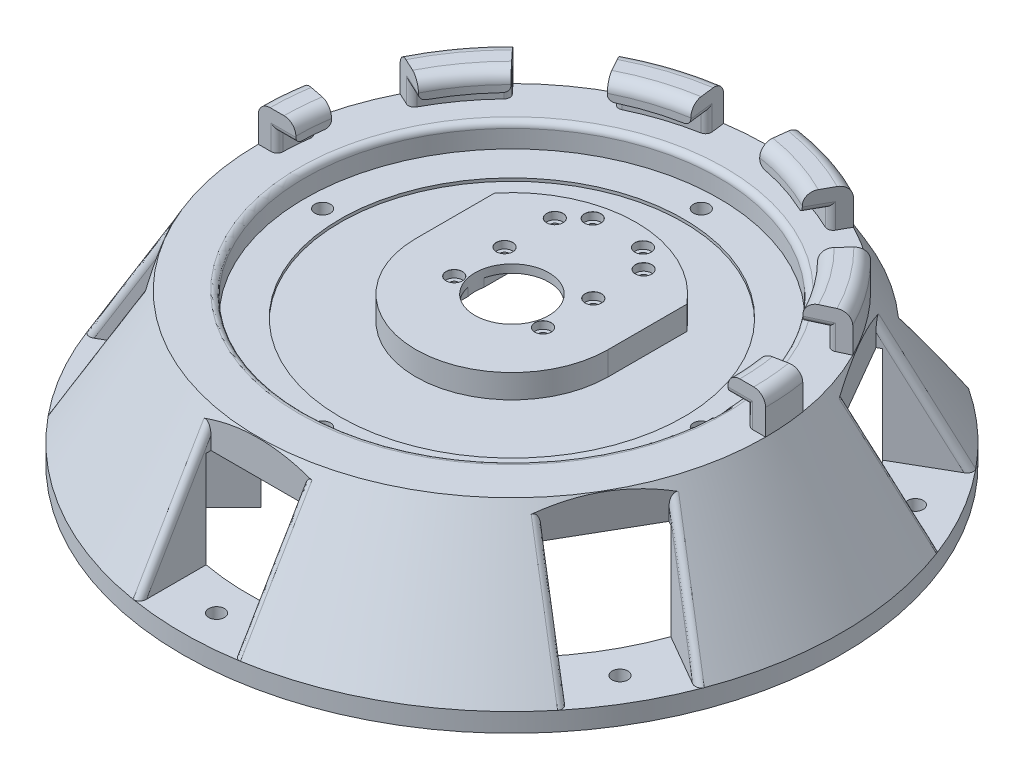
from build123d import *

# Parameters (mm, degrees)
SKETCH2_R                       = 12.5
CUT_EXTRUDE1_DEPTH              = 171.457229262
SKETCH3_R                       = 69.999999954
CUT_EXTRUDE2_DEPTH              = 8.000000002
CUT_EXTRUDE5_DEPTH              = 39
SKETCH8_W                       = 31.75
SKETCH8_H                       = 38.1
CUT_EXTRUDE6_DEPTH              = 44.45
CIRPATTERN2_COUNT               = 6
SKETCH9_R                       = 2.649982
CUT_EXTRUDE7_DEPTH              = 171.457229262
CIRPATTERN3_COUNT               = 6
REVOLVE2_ANGLE                  = 180
CUT_EXTRUDE9_DEPTH              = 12.7
SKETCH3_3_R                     = 12.5
CUT_EXTRUDE11_DEPTH             = 1
CBORE_FOR_M2_5_SHCS1_AT_2_COUNT = 2
CBORE_FOR_M2_5_SHCS1_AT_2_PITCH = 17
CBORE_FOR_M2_5_SHCS1_AT_3_COUNT = 2
CBORE_FOR_M2_5_SHCS1_AT_3_PITCH = 34
CBORE_FOR_M2_5_SHCS1_AT_4_COUNT = 2
CBORE_FOR_M2_5_SHCS1_AT_4_PITCH = 40.820828017
CBORE_FOR_M2_5_SHCS1_AT_5_COUNT = 2
CBORE_FOR_M2_5_SHCS1_AT_5_PITCH = 46.651259361
CBORE_FOR_M2_5_SHCS1_AT_6_COUNT = 2
CBORE_FOR_M2_5_SHCS1_AT_6_PITCH = 45.343136195
CBORE_FOR_M2_5_SHCS1_AT_7_COUNT = 2
CBORE_FOR_M2_5_SHCS1_AT_7_PITCH = 34.481879299
CBORE_FOR_M2_5_SHCS1_AT_8_COUNT = 2
CBORE_FOR_M2_5_SHCS1_AT_8_PITCH = 30
FILLET1_R                       = 4
FILLET2_R                       = 2
FILLET3_R                       = 2
FILLET4_R                       = 2
FILLET5_R                       = 2
FILLET9_R                       = 1
CUT_EXTRUDE12_DEPTH             = 8.05
CUT_EXTRUDE15_START             = -5.3
SKETCH20_R                      = 1.45
CUT_EXTRUDE15_DEPTH             = 5.3
M5_CLEARANCE_HOLE1_D            = 5.3
SKETCH34_R                      = 58
CUT_EXTRUDE16_DEPTH             = 1
BOSS_EXTRUDE1_DEPTH             = 39
FILLET10_R                      = 10
SKETCH37_R                      = 121.388219465
SKETCH37_R_2                    = 111.388219465
CUT_EXTRUDE_THIN1_DEPTH         = 171.457229427


with BuildPart() as part:
    # Sketch1 → Revolve1 (revolve)
    with BuildSketch(Plane.XY, mode=Mode.PRIVATE) as revolve1_sk:
        Polygon((0, 0), (-85.725, 0), (-115.054393675, -50.8), (0, -50.8), align=None)
    revolve(revolve1_sk.sketch.rotate(Axis((0, 0, 0), (0, -1, 0)), 270), axis=Axis((0, 0, 0), (0, -1, 0)))

    # Sketch2 → Cut-Extrude1 (cut, through all)
    with BuildSketch(Plane(origin=(0, 0, 0), x_dir=(1, 0, 0), z_dir=(0, 1, 0))):
        with Locations(Location((0, 0, 0), (0, 0, 270))):
            Circle(SKETCH2_R)
    extrude(amount=-CUT_EXTRUDE1_DEPTH, mode=Mode.SUBTRACT)

    # Sketch3 → Cut-Extrude2 (cut)
    with BuildSketch(Plane(origin=(0, 0, 0), x_dir=(1, 0, 0), z_dir=(0, 1, 0))):
        with Locations(Location((0, 0, 0), (0, 0, 270))):
            Circle(SKETCH3_R)
        with BuildLine():
            ThreePointArc((32.5, 0), (0, -32.5), (-32.5, 0))
            Line((-32.5, 0), (-32.5, 26.603571189))
            ThreePointArc((-32.5, 26.603571189), (0, 42), (32.5, 26.603571189))
            Line((32.5, 26.603571189), (32.5, 0))
        make_face(mode=Mode.SUBTRACT)
    extrude(amount=-CUT_EXTRUDE2_DEPTH, mode=Mode.SUBTRACT)

    # Sketch7 → Cut-Extrude5 (cut)
    with BuildSketch(Plane.XZ.offset(50.8)):
        with BuildLine():
            Line((-60, -65.598856697), (-60, -161.1))
            Line((-60, -161.1), (60, -161.1))
            Line((60, -161.1), (60, -65.598856697))
            ThreePointArc((60, -65.598856697), (0, 88.9), (-60, -65.598856697))
        make_face()
    extrude(amount=-CUT_EXTRUDE5_DEPTH, mode=Mode.SUBTRACT)

    # Sketch8 → Cut-Extrude6 (cut)
    with BuildSketch(Plane(origin=(0, 0, 0), x_dir=(1, 0, 0), z_dir=(0, 1, 0))):
        with Locations((0, -104.875)):
            Rectangle(SKETCH8_W, SKETCH8_H)
    cut_extrude6 = extrude(amount=-CUT_EXTRUDE6_DEPTH, mode=Mode.SUBTRACT)

    # CirPattern2: Cut-Extrude6 ×6 about axis, 1 skipped
    cirpattern2_axis = Axis((0, 0, 0), (0, -1, 0))
    add([cut_extrude6.rotate(cirpattern2_axis, i * 360 / CIRPATTERN2_COUNT) for i in range(1, CIRPATTERN2_COUNT) if i not in (3,)], mode=Mode.SUBTRACT)

    # Sketch9 → Cut-Extrude7 (cut, through all)
    with BuildSketch(Plane(origin=(0, 0, 0), x_dir=(1, 0, 0), z_dir=(0, 1, 0))):
        with Locations(Location((0, -99.814393675, 0), (0, 0, 270))):
            Circle(SKETCH9_R)
    cut_extrude7 = extrude(amount=-CUT_EXTRUDE7_DEPTH, mode=Mode.SUBTRACT)

    # CirPattern3: Cut-Extrude7 ×6 about axis
    cirpattern3_axis = Axis((0, 0, 0), (0, 1, 0))
    for i in range(1, CIRPATTERN3_COUNT):
        add(cut_extrude7.rotate(cirpattern3_axis, i * 360 / CIRPATTERN3_COUNT), mode=Mode.SUBTRACT)

    # Sketch12 → Revolve2 (revolve)
    with BuildSketch(Plane.XY):
        Polygon((85.725, 0), (85.725, 12.7), (73.025, 12.7), (73.025, 6.35), (79.375, 6.35), (79.375, 0), align=None)
    revolve(axis=Axis((0, 0, 0), (0, 1, 0)), revolution_arc=REVOLVE2_ANGLE)

    # Sketch18 → Cut-Extrude9 (cut)
    with BuildSketch(Plane(origin=(0, 12.7, 0), x_dir=(1, 0, 0), z_dir=(0, 1, 0))):
        Polygon((46.643270314, 89.718478222), (70.913780145, 72.084920653), (36.670415564, 35.160782448), (22.108109665, 45.740916989), align=None)
        Polygon((-15, 100), (-9, 50), (9, 50), (15, 100), align=None)
        Polygon((90.470396714, 45.167547182), (99.740906545, 16.635851693), (50.333978764, 6.891341072), (44.771672865, 24.010358365), align=None)
        Polygon((99.740906545, -16.635851693), (90.470396714, -45.167547182), (44.771672865, -24.010358365), (50.333978764, -6.891341072), align=None)
        Polygon((70.913780145, -72.084920653), (46.643270314, -89.718478222), (22.108109665, -45.740916989), (36.670415564, -35.160782448), align=None)
        Polygon((15, -100), (-15, -100), (-9, -50), (9, -50), align=None)
        Polygon((-46.643270314, -89.718478222), (-70.913780145, -72.084920653), (-36.670415564, -35.160782448), (-22.108109665, -45.740916989), align=None)
        Polygon((-90.470396714, -45.167547182), (-99.740906545, -16.635851693), (-50.333978764, -6.891341072), (-44.771672865, -24.010358365), align=None)
        Polygon((-99.740906545, 16.635851693), (-90.470396714, 45.167547182), (-44.771672865, 24.010358365), (-50.333978764, 6.891341072), align=None)
        Polygon((-70.913780145, 72.084920653), (-46.643270314, 89.718478222), (-22.108109665, 45.740916989), (-36.670415564, 35.160782448), align=None)
    extrude(amount=-CUT_EXTRUDE9_DEPTH, mode=Mode.SUBTRACT)

    # Sketch3<3> → Cut-Extrude11 (cut)
    # profile 1 of 5: a face of its own
    with BuildSketch(Plane(origin=(0, 0, 0), x_dir=(1, 0, 0), z_dir=(0, 1, 0))):
        with BuildLine():
            ThreePointArc((-18.668154703, 26.603571189), (-28.835438507, 14.992247533), (-32.5, 0))
            ThreePointArc((-32.5, 0), (0, -32.5), (32.5, 0))
            ThreePointArc((32.5, 0), (28.835438507, 14.992247533), (18.668154703, 26.603571189))
            Line((18.668154703, 26.603571189), (-18.668154703, 26.603571189))
        make_face()
        with Locations(Location((0, 0, 0), (0, 0, 270))):
            Circle(SKETCH3_3_R, mode=Mode.SUBTRACT)
    # profile 2 of 5: a face of its own
    with BuildSketch(Plane(origin=(0, 0, 0), x_dir=(1, 0, 0), z_dir=(0, 1, 0))):
        with BuildLine():
            Line((-32.5, 26.603571189), (-32.5, 0))
            ThreePointArc((-32.5, 0), (-28.835438507, 14.992247533), (-18.668154703, 26.603571189))
            Line((-18.668154703, 26.603571189), (-32.5, 26.603571189))
        make_face()
    # profile 3 of 5: a face of its own
    with BuildSketch(Plane(origin=(0, 0, 0), x_dir=(1, 0, 0), z_dir=(0, 1, 0))):
        with BuildLine():
            ThreePointArc((18.668154703, 26.603571189), (0, 32.5), (-18.668154703, 26.603571189))
            Line((-18.668154703, 26.603571189), (18.668154703, 26.603571189))
        make_face()
    # profile 4 of 5: a face of its own
    with BuildSketch(Plane(origin=(0, 0, 0), x_dir=(1, 0, 0), z_dir=(0, 1, 0))):
        with BuildLine():
            ThreePointArc((32.5, 26.603571189), (0, 42), (-32.5, 26.603571189))
            Line((-32.5, 26.603571189), (-18.668154703, 26.603571189))
            ThreePointArc((-18.668154703, 26.603571189), (0, 32.5), (18.668154703, 26.603571189))
            Line((18.668154703, 26.603571189), (32.5, 26.603571189))
        make_face()
    # profile 5 of 5: a face of its own
    with BuildSketch(Plane(origin=(0, 0, 0), x_dir=(1, 0, 0), z_dir=(0, 1, 0))):
        with BuildLine():
            ThreePointArc((18.668154703, 26.603571189), (28.835438507, 14.992247533), (32.5, 0))
            Line((32.5, 0), (32.5, 26.603571189))
            Line((32.5, 26.603571189), (18.668154703, 26.603571189))
        make_face()
    extrude(amount=-CUT_EXTRUDE11_DEPTH, mode=Mode.SUBTRACT)

    # Sketch24 → CBORE for M2.5 SHCS1 (revolve, cut)
    with BuildSketch(Plane(origin=(-15, -1, 4.5), x_dir=(0, 0, 1), z_dir=(1, 0, 0))):
        Polygon((0, 0), (0, 49.8), (1.45, 49.8), (1.45, 2.5), (2.75, 2.5), (2.75, 0.025), (2.775, 0), align=None)
    cbore_for_m2_5_shcs1 = revolve(axis=Axis((-15, 5.35, 4.5), (0, -1, 0)), mode=Mode.SUBTRACT)

    # CBORE for M2.5 SHCS1 at 2: CBORE for M2.5 SHCS1 ×2
    with Locations(*[(0, 0, -i * CBORE_FOR_M2_5_SHCS1_AT_2_PITCH) for i in range(1, CBORE_FOR_M2_5_SHCS1_AT_2_COUNT)]):
        add(cbore_for_m2_5_shcs1, mode=Mode.SUBTRACT)

    # CBORE for M2.5 SHCS1 at 3: CBORE for M2.5 SHCS1 ×2
    with Locations(*[(0, 0, -i * CBORE_FOR_M2_5_SHCS1_AT_3_PITCH) for i in range(1, CBORE_FOR_M2_5_SHCS1_AT_3_COUNT)]):
        add(cbore_for_m2_5_shcs1, mode=Mode.SUBTRACT)

    # CBORE for M2.5 SHCS1 at 4: CBORE for M2.5 SHCS1 ×2
    with Locations(*[Vector(0.15923243882462063, 0, -0.9872411207126472) * (i * CBORE_FOR_M2_5_SHCS1_AT_4_PITCH) for i in range(1, CBORE_FOR_M2_5_SHCS1_AT_4_COUNT)]):
        add(cbore_for_m2_5_shcs1, mode=Mode.SUBTRACT)

    # CBORE for M2.5 SHCS1 at 5: CBORE for M2.5 SHCS1 ×2
    with Locations(*[Vector(0.5037377408822789, 0, -0.8638566364917376) * (i * CBORE_FOR_M2_5_SHCS1_AT_5_PITCH) for i in range(1, CBORE_FOR_M2_5_SHCS1_AT_5_COUNT)]):
        add(cbore_for_m2_5_shcs1, mode=Mode.SUBTRACT)

    # CBORE for M2.5 SHCS1 at 6: CBORE for M2.5 SHCS1 ×2
    with Locations(*[Vector(0.6616216370868465, 0, -0.7498378553650925) * (i * CBORE_FOR_M2_5_SHCS1_AT_6_PITCH) for i in range(1, CBORE_FOR_M2_5_SHCS1_AT_6_COUNT)]):
        add(cbore_for_m2_5_shcs1, mode=Mode.SUBTRACT)

    # CBORE for M2.5 SHCS1 at 7: CBORE for M2.5 SHCS1 ×2
    with Locations(*[Vector(0.8700221858486125, 0, -0.4930125719808802) * (i * CBORE_FOR_M2_5_SHCS1_AT_7_PITCH) for i in range(1, CBORE_FOR_M2_5_SHCS1_AT_7_COUNT)]):
        add(cbore_for_m2_5_shcs1, mode=Mode.SUBTRACT)

    # CBORE for M2.5 SHCS1 at 8: CBORE for M2.5 SHCS1 ×2
    with Locations(*[(i * CBORE_FOR_M2_5_SHCS1_AT_8_PITCH, 0, 0) for i in range(1, CBORE_FOR_M2_5_SHCS1_AT_8_COUNT)]):
        add(cbore_for_m2_5_shcs1, mode=Mode.SUBTRACT)

    # Fillet1
    fillet1_edges = [part.edges().sort_by_distance(p)[0] for p in [
        (-85.450905057, 12.7, -6.849704366),
        (-72.808821363, 12.7, -5.614815819),
        (-59.078466014, 12.7, -42.923018049),
        (-22.565966014, 12.7, -69.450902102),
        (22.565966014, 12.7, -69.450902102),
        (59.078466014, 12.7, -42.923018049),
        (72.808821363, 12.7, -5.614815819),
        (-69.352981843, 12.7, -50.387890753),
        (-26.490481843, 12.7, -81.529319859),
        (26.490481843, 12.7, -81.529319859),
        (69.352981843, 12.7, -50.387890753),
        (85.450905057, 12.7, -6.849704365),
    ]]
    fillet(fillet1_edges, radius=FILLET1_R)

    # Fillet2
    fillet2_edges = [part.edges().sort_by_distance(p)[0] for p in [
        (-76.2, 6.35, 0),
        (76.2, 6.35, 0),
        (67.844410645, 6.35, -34.692369341),
        (75.278944251, 6.35, -11.811227656),
        (34.49561812, 6.35, -67.9446604),
        (53.95947979, 6.35, -53.803337137),
        (-75.278944251, 6.35, -11.811227656),
        (-67.844410645, 6.35, -34.692369341),
        (-53.95947979, 6.35, -53.803337137),
        (-34.49561812, 6.35, -67.9446604),
        (12.029328065, 6.35, -75.24440054),
        (-12.029328065, 6.35, -75.24440054),
    ]]
    fillet(fillet2_edges, radius=FILLET2_R)

    # Fillet3
    fillet3_edges = [part.edges().sort_by_distance(p)[0] for p in [
        (-78.396323126, 4.175, -12.426067172),
        (-56.120098678, 4.175, -56.133102082),
        (-70.727816733, 4.175, -36.027303052),
        (-12.407903987, 4.175, -78.399199892),
        (56.120098678, 4.175, -56.133102082),
        (78.396323126, 4.175, -12.426067171),
        (-79.375, 4.175, 0),
        (-36.043688298, 4.175, -70.719468033),
        (12.407903987, 4.175, -78.399199892),
        (36.043688298, 4.175, -70.719468033),
        (70.727816733, 4.175, -36.027303052),
        (79.375, 4.175, 0),
    ]]
    fillet(fillet3_edges, radius=FILLET3_R)

    # Fillet4
    fillet4_edges = [part.edges().sort_by_distance(p)[0] for p in [
        (92.853698409, -23.56380487, 35.278236725),
        (76.978698409, -23.56380487, 62.774543295),
        (76.978698409, -23.56380487, -62.774543295),
        (92.853698409, -23.56380487, -35.278236725),
        (-92.853698409, -23.56380487, -35.278236725),
        (-76.978698409, -23.56380487, -62.774543295),
        (-76.978698409, -23.56380487, 62.774543295),
        (-92.853698409, -23.56380487, 35.278236725),
        (15.875, -23.56380487, 98.05278002),
        (-15.875, -23.56380487, 98.05278002),
    ]]
    fillet(fillet4_edges, radius=FILLET4_R)

    # Fillet5
    fillet5_edges = [part.edges().sort_by_distance(p)[0] for p in [
        (0, 0, -69.999999954),
    ]]
    fillet(fillet5_edges, radius=FILLET5_R)

    # Fillet9
    fillet9_edges = [part.edges().sort_by_distance(p)[0] for p in [
        (-60, -31.116866881, -84.56763471),
        (60, -31.116866881, -84.56763471),
    ]]
    fillet(fillet9_edges, radius=FILLET9_R)

    # Sketch28 → Cut-Extrude12 (cut)
    with BuildSketch(Plane.XZ.offset(11.8)):
        with BuildLine():
            Line((9.2, 12), (-9.2, 12))
            ThreePointArc((-9.2, 12), (-11.321320344, 11.121320344), (-12.2, 9))
            Line((-12.2, 9), (-12.2, -30))
            ThreePointArc((-12.2, -30), (-11.321320344, -32.121320344), (-9.2, -33))
            Line((-9.2, -33), (9.2, -33))
            ThreePointArc((9.2, -33), (11.321320344, -32.121320344), (12.2, -30))
            Line((12.2, -30), (12.2, 9))
            ThreePointArc((12.2, 9), (11.321320344, 11.121320344), (9.2, 12))
        make_face()
    extrude(amount=-CUT_EXTRUDE12_DEPTH, mode=Mode.SUBTRACT)

    # Sketch20 → Cut-Extrude15 (cut)
    with BuildSketch(Plane.XZ.offset(11.8).offset(CUT_EXTRUDE15_START)):
        Polygon((-22.5, 23), (-22.5, -33), (-12.5, -40), (12.5, -40), (22.5, -33), (22.5, 23), align=None)
        with Locations(Location((-15, -29.5, 0), (0, 0, 90))):
            Circle(SKETCH20_R, mode=Mode.SUBTRACT)
        with Locations(Location((-8.5, -35.8, 0), (0, 0, 90))):
            Circle(SKETCH20_R, mode=Mode.SUBTRACT)
        with Locations(Location((-15, -12.5, 0), (0, 0, 90))):
            Circle(SKETCH20_R, mode=Mode.SUBTRACT)
        with Locations(Location((8.5, -35.8, 0), (0, 0, 90))):
            Circle(SKETCH20_R, mode=Mode.SUBTRACT)
        with Locations(Location((15, -29.5, 0), (0, 0, 90))):
            Circle(SKETCH20_R, mode=Mode.SUBTRACT)
        with BuildLine():
            Line((-9.2, 12), (-3.5, 12))
            ThreePointArc((-3.5, 12), (-1.767766953, 12.374368671), (0, 12.5))
            ThreePointArc((0, 12.5), (1.767766953, 12.374368671), (3.5, 12))
            Line((3.5, 12), (9.2, 12))
            ThreePointArc((9.2, 12), (11.321320344, 11.121320344), (12.2, 9))
            Line((12.2, 9), (12.2, 2.722131518))
            ThreePointArc((12.2, 2.722131518), (12.5, 0), (12.2, -2.722131518))
            Line((12.2, -2.722131518), (12.2, -30))
            ThreePointArc((12.2, -30), (11.321320344, -32.121320344), (9.2, -33))
            Line((9.2, -33), (-9.2, -33))
            ThreePointArc((-9.2, -33), (-11.321320344, -32.121320344), (-12.2, -30))
            Line((-12.2, -30), (-12.2, -2.722131518))
            ThreePointArc((-12.2, -2.722131518), (-12.5, 0), (-12.2, 2.722131518))
            Line((-12.2, 2.722131518), (-12.2, 9))
            ThreePointArc((-12.2, 9), (-11.321320344, 11.121320344), (-9.2, 12))
        make_face(mode=Mode.SUBTRACT)
        with Locations(Location((15, -12.5, 0), (0, 0, 90))):
            Circle(SKETCH20_R, mode=Mode.SUBTRACT)
        with Locations(Location((-15, 4.5, 0), (0, 0, 90))):
            Circle(SKETCH20_R, mode=Mode.SUBTRACT)
        with Locations(Location((15, 4.5, 0), (0, 0, 90))):
            Circle(SKETCH20_R, mode=Mode.SUBTRACT)
    extrude(amount=CUT_EXTRUDE15_DEPTH, mode=Mode.SUBTRACT)

    # M5 Clearance Hole1 (through all)
    with Locations(Plane(origin=(0, -8.000000002, 0), x_dir=(1, 0, 0), z_dir=(0, 1, 0))):
        with Locations((0, 64), (64, 0), (0, -64), (-64, 0)):
            Hole(M5_CLEARANCE_HOLE1_D / 2)

    # Sketch34 → Cut-Extrude16 (cut)
    with BuildSketch(Plane(origin=(0, -8.000000002, 0), x_dir=(1, 0, 0), z_dir=(0, 1, 0))):
        with Locations(Location((0, 0, 0), (0, 0, 270))):
            Circle(SKETCH34_R)
        with BuildLine():
            ThreePointArc((32.5, 0), (0, -32.5), (-32.5, 0))
            Line((-32.5, 0), (-32.5, 26.603571189))
            ThreePointArc((-32.5, 26.603571189), (0, 42), (32.5, 26.603571189))
            Line((32.5, 26.603571189), (32.5, 0))
        make_face(mode=Mode.SUBTRACT)
    extrude(amount=-CUT_EXTRUDE16_DEPTH, mode=Mode.SUBTRACT)

    # Sketch39 → Boss-Extrude1 (add)
    with BuildSketch(Plane.XZ.offset(50.8)):
        with BuildLine():
            ThreePointArc((-48.831845645, 74.287689767), (-56.138266806, 68.932612021), (-62.861792847, 62.861792847))
            Line((-62.861792847, 62.861792847), (-42.426406871, 42.426406871))
            Line((-42.426406871, 42.426406871), (-29.69848481, 55.154328933))
            Line((-29.69848481, 55.154328933), (-48.831845645, 74.287689767))
        make_face()
        with BuildLine():
            Line((-72, 12.5), (-88.016816575, 12.5))
            ThreePointArc((-88.016816575, 12.5), (-88.9, 0), (-88.016816575, -12.5))
            Line((-88.016816575, -12.5), (-72, -12.5))
            Line((-72, -12.5), (-72, 12.5))
        make_face()
        with BuildLine():
            ThreePointArc((62.861792847, 62.861792847), (56.138266806, 68.932612021), (48.831845645, 74.287689767))
            Line((48.831845645, 74.287689767), (29.69848481, 55.154328933))
            Line((29.69848481, 55.154328933), (42.426406871, 42.426406871))
            Line((42.426406871, 42.426406871), (62.861792847, 62.861792847))
        make_face()
        with BuildLine():
            ThreePointArc((88.016816575, -12.5), (88.9, 0), (88.016816575, 12.5))
            Line((88.016816575, 12.5), (72, 12.5))
            Line((72, 12.5), (72, -12.5))
            Line((72, -12.5), (88.016816575, -12.5))
        make_face()
    extrude(amount=-BOSS_EXTRUDE1_DEPTH)

    # Fillet10
    fillet10_edges = [part.edges().sort_by_distance(p)[0] for p in [
        (-36.062445841, -11.8, 48.790367902),
        (36.062445841, -11.8, 48.790367902),
    ]]
    fillet(fillet10_edges, radius=FILLET10_R)

    # Sketch37 → Cut-Extrude-Thin1 (cut, through all)
    with BuildSketch(Plane(origin=(0, 0, 0), x_dir=(1, 0, 0), z_dir=(0, 1, 0))):
        Circle(SKETCH37_R)
        Circle(SKETCH37_R_2, mode=Mode.SUBTRACT)
    extrude(amount=-CUT_EXTRUDE_THIN1_DEPTH, mode=Mode.SUBTRACT)


solid = part.part
